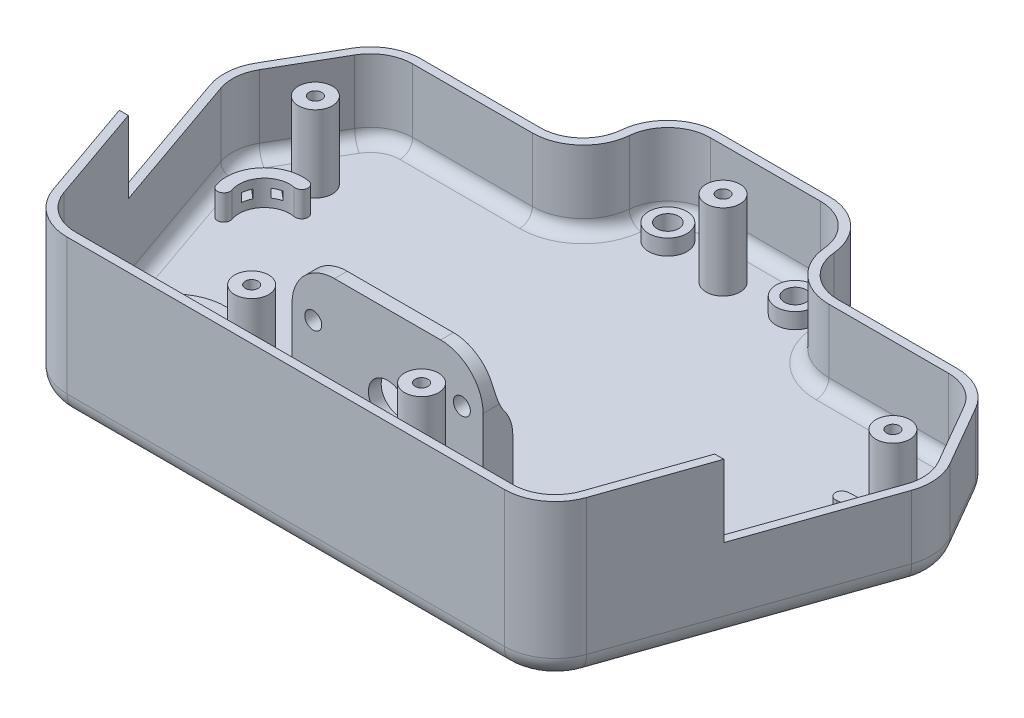
from build123d import *

# Parameters (mm, degrees)
BOSS_EXTRUDE1_DEPTH     = 2
BOSS_EXTRUDE2_DEPTH     = 35
BOSS_EXTRUDE3_START     = -2
SKETCH3_R               = 4.5
BOSS_EXTRUDE3_DEPTH     = 5.7
SKETCH5_R               = 2.55
CUT_EXTRUDE1_DEPTH      = 175.953563197
BOSS_EXTRUDE4_DEPTH     = 6
CUT_EXTRUDE2_REACH      = 176.805
CUT_EXTRUDE2_END_RADIUS = 9
SKETCH7_W               = 2
SKETCH7_H               = 2
SKETCH8_W               = 45
SKETCH8_H               = 34
BOSS_EXTRUDE5_DEPTH     = 3
SKETCH9_W               = 3
SKETCH9_H               = 4
BOSS_EXTRUDE6_DEPTH     = 20
FILLET1_R               = 10
FILLET2_R               = 10
SKETCH11_R              = 12.5
BOSS_EXTRUDE9_DEPTH     = 10
CUT_EXTRUDE3_START      = -3
CUT_EXTRUDE3_DEPTH      = 5
SKETCH14_R              = 2.5
CUT_EXTRUDE4_DEPTH      = 8
SKETCH15_R              = 2
SKETCH15_R_2            = 4.5
CUT_EXTRUDE5_DEPTH      = 3
FILLET3_R               = 10
FILLET4_R               = 12
FILLET5_R               = 10
FILLET6_R               = 3
FILLET7_R               = 5
CUT_EXTRUDE6_DEPTH      = 176.517870935
CUT_EXTRUDE6_DEPTH_BACK = 176.517870935
SKETCH16_W              = 90
SKETCH16_H              = 20
SKETCH17_R              = 4
SKETCH17_R_2            = 1.5
BOSS_EXTRUDE10_DEPTH    = 18
SKETCH19_R              = 4
SKETCH19_R_2            = 1.5
BOSS_EXTRUDE11_DEPTH    = 35


with BuildPart() as part:
    # Sketch1 → Boss-Extrude1 (new body)
    with BuildSketch(Plane(origin=(0, 0, 0), x_dir=(1, 0, 0), z_dir=(0, 1, 0))):
        Polygon((-70, -55), (-25, -55), (-25, -35), (25, -35), (25, -55), (70, -55), (84.43375673, -80), (60, -150), (-60, -150), (-84.43375673, -80), align=None)
    extrude(amount=BOSS_EXTRUDE1_DEPTH)

    # Sketch2 → Boss-Extrude2 (add)
    with BuildSketch(Plane(origin=(0, 2, 0), x_dir=(1, 0, 0), z_dir=(0, 1, 0))):
        Polygon((84.43375673, -80), (70, -55), (25, -55), (25, -35), (-25, -35), (-25, -55), (-70, -55), (-84.43375673, -80), (-60, -150), (60, -150), align=None)
        Polygon((68.845299462, -57), (23, -57), (23, -37), (-23, -37), (-23, -57), (-68.845299462, -57), (-82.243429624, -80.206242168), (-58.579769814, -148), (58.579769814, -148), (82.243429624, -80.206242168), align=None, mode=Mode.SUBTRACT)
    extrude(amount=BOSS_EXTRUDE2_DEPTH)

    # Sketch3 → Boss-Extrude3 (add)
    with BuildSketch(Plane(origin=(0, 2, 0), x_dir=(1, 0, 0), z_dir=(0, 1, 0)).offset(BOSS_EXTRUDE3_START)):
        with Locations(Location((-15, -45, 0), (0, 0, 90))):
            Circle(SKETCH3_R)
        with Locations(Location((15, -45, 0), (0, 0, 90))):
            Circle(SKETCH3_R)
    extrude(amount=BOSS_EXTRUDE3_DEPTH)

    # Sketch5 → Cut-Extrude1 (cut, through all)
    with BuildSketch(Plane(origin=(0, 5.7, 0), x_dir=(1, 0, 0), z_dir=(0, 1, 0))):
        with Locations(Location((-15, -45, 0), (0, 0, 270))):
            Circle(SKETCH5_R)
        with Locations(Location((15, -45, 0), (0, 0, 270))):
            Circle(SKETCH5_R)
    extrude(amount=-CUT_EXTRUDE1_DEPTH, mode=Mode.SUBTRACT)

    # Sketch6 → Boss-Extrude4 (add)
    with BuildSketch(Plane(origin=(0, 2, 0), x_dir=(1, 0, 0), z_dir=(0, 1, 0))):
        with BuildLine():
            ThreePointArc((-63.880004789, -84.105459244), (-69.544824433, -86.082785317), (-70.664819644, -91.977326073))
            ThreePointArc((-70.664819644, -91.977326073), (-71.586693037, -93.887862502), (-73.497229466, -92.965989109))
            ThreePointArc((-73.497229466, -92.965989109), (-71.817236649, -84.124177975), (-63.320007183, -81.158188866))
            ThreePointArc((-63.320007183, -81.158188866), (-62.126370797, -82.911822858), (-63.880004789, -84.105459244))
        make_face()
    boss_extrude4 = extrude(amount=BOSS_EXTRUDE4_DEPTH)

    # Cut-Extrude2: up to this cylinder (the profile starts inside it)
    cut_extrude2_end = Plane(origin=(-65, 5, 90), z_dir=(0, -1, 0)) * Cylinder(CUT_EXTRUDE2_END_RADIUS, 372.61, mode=Mode.PRIVATE)
    # Sketch7 → Cut-Extrude2 (cut, up to the surface)
    with BuildSketch(Plane(origin=(5.508798531, 0, 4.748070429), x_dir=(0.6528691138796593, 0, -0.7574707388024889), z_dir=(0.7574707388024889, 0, 0.6528691138796593)), mode=Mode.PRIVATE) as cut_extrude2_sk1:
        with Locations((-113.108858894, 5)):
            Rectangle(SKETCH7_W, SKETCH7_H)
    cut_extrude2_tool1 = extrude(cut_extrude2_sk1.sketch, amount=-CUT_EXTRUDE2_REACH, mode=Mode.PRIVATE) & cut_extrude2_end
    # Sketch7 → Cut-Extrude2 (cut, up to the surface)
    with BuildSketch(Plane(origin=(5.508798531, 0, 4.748070429), x_dir=(0.6528691138796593, 0, -0.7574707388024889), z_dir=(0.7574707388024889, 0, 0.6528691138796593)), mode=Mode.PRIVATE) as cut_extrude2_sk2:
        with Locations((-108.108858894, 5)):
            Rectangle(SKETCH7_W, SKETCH7_H)
    cut_extrude2_tool2 = extrude(cut_extrude2_sk2.sketch, amount=-CUT_EXTRUDE2_REACH, mode=Mode.PRIVATE) & cut_extrude2_end
    cut_extrude2 = cut_extrude2_tool1.solids().sort_by_distance((-68.336482, 5, 90.424721))[0] + cut_extrude2_tool2.solids().sort_by_distance((-65.072136, 5, 86.637368))[0]
    add(cut_extrude2, mode=Mode.SUBTRACT)

    # Sketch8 → Boss-Extrude5 (add)
    with BuildSketch(Plane(origin=(0, 0, 126), x_dir=(-1, 0, 0), z_dir=(0, 0, -1))):
        with Locations((0, 19)):
            Rectangle(SKETCH8_W, SKETCH8_H)
    extrude(amount=BOSS_EXTRUDE5_DEPTH)

    # Sketch9 → Boss-Extrude6 (add)
    with BuildSketch(Plane(origin=(0, 2, 0), x_dir=(1, 0, 0), z_dir=(0, 1, 0))):
        with Locations((-21, -121)):
            Rectangle(SKETCH9_W, SKETCH9_H)
        with Locations((21, -121)):
            Rectangle(SKETCH9_W, SKETCH9_H)
    extrude(amount=BOSS_EXTRUDE6_DEPTH)

    # Fillet1
    # the kernel refuses this fillet: 10 mm, written as the material it adds along each edge
    with BuildSketch(Plane(origin=(-22.5, 22, 123), x_dir=(0, 0, -1), z_dir=(1, 0, 0))) as fillet1_piece_1:
        with BuildLine():
            CenterArc((10, 8), FILLET1_R, 180, 53.130102354)
            Line((0, 8), (-0.2, 8))
            Line((-0.2, 8), (-0.2, 0))
            Line((-0.2, 0), (0, -0.2))
            ThreePointArc((0, -0.2), (2, -0.2), (3.88, -0.16))
            Line((3.88, -0.16), (4, 0))
        make_face()
    extrude(amount=3)
    with BuildSketch(Plane(origin=(22.5, 22, 123), x_dir=(0, 1, 0), z_dir=(-1, 0, 0))) as fillet1_piece_2:
        with BuildLine():
            CenterArc((8, 10), FILLET1_R, 216.869897646, 53.130102354)
            Line((0, 4), (-0.16, 3.88))
            ThreePointArc((-0.16, 3.88), (-0.2, 2), (-0.2, 0))
            Line((-0.2, 0), (0, -0.2))
            Line((0, -0.2), (8, -0.2))
            Line((8, -0.2), (8, 0))
        make_face()
    extrude(amount=3)

    # Fillet2
    fillet2_edges = [part.edges().sort_by_distance(p)[0] for p in [
        (-21, 22, 119),
        (21, 22, 119),
    ]]
    fillet(fillet2_edges, radius=FILLET2_R)

    # Sketch11 → Boss-Extrude9 (add)
    with BuildSketch(Plane(origin=(0, 2, 0), x_dir=(1, 0, 0), z_dir=(0, 1, 0))):
        with Locations(Location((-43.579769814, -133, 0), (0, 0, 90))):
            Circle(SKETCH11_R)
    boss_extrude9 = extrude(amount=BOSS_EXTRUDE9_DEPTH)

    # Sketch13 → Cut-Extrude3 (cut)
    with BuildSketch(Plane(origin=(0, 7, 0), x_dir=(1, 0, 0), z_dir=(0, 1, 0)).offset(CUT_EXTRUDE3_START)):
        with BuildLine():
            Line((-53.021135888, -136.295543455), (-58.294005416, -121.189357737))
            Line((-58.294005416, -121.189357737), (-39.411273269, -114.598270827))
            Line((-39.411273269, -114.598270827), (-34.138403741, -129.704456545))
            ThreePointArc((-34.138403741, -129.704456545), (-40.28422636, -142.441366074), (-53.021135888, -136.295543455))
        make_face()
    cut_extrude3 = extrude(amount=CUT_EXTRUDE3_DEPTH, mode=Mode.SUBTRACT)

    # Sketch14 → Cut-Extrude4 (cut)
    with BuildSketch(Plane(origin=(0, 12, 0), x_dir=(1, 0, 0), z_dir=(0, 1, 0))):
        with Locations(Location((-43.579769814, -133, 0), (0, 0, 270))):
            Circle(SKETCH14_R)
    cut_extrude4 = extrude(amount=-CUT_EXTRUDE4_DEPTH, mode=Mode.SUBTRACT)

    # Sketch15 → Cut-Extrude5 (cut)
    with BuildSketch(Plane.XY.offset(126)):
        with Locations((17.5, 25)):
            Circle(SKETCH15_R)
        with Locations((-17.5, 25)):
            Circle(SKETCH15_R)
        with Locations((0, 17)):
            Circle(SKETCH15_R_2)
    extrude(amount=-CUT_EXTRUDE5_DEPTH, mode=Mode.SUBTRACT)

    # Mirror1: Boss-Extrude4, Cut-Extrude2, Boss-Extrude9, Cut-Extrude3, Cut-Extrude4 across plane
    add(boss_extrude4.mirror(Plane(origin=(0, 0, 0), x_dir=(0, 0, 1), z_dir=(1, 0, 0))))
    add(cut_extrude2.mirror(Plane(origin=(0, 0, 0), x_dir=(0, 0, 1), z_dir=(1, 0, 0))), mode=Mode.SUBTRACT)
    add(boss_extrude9.mirror(Plane(origin=(0, 0, 0), x_dir=(0, 0, 1), z_dir=(1, 0, 0))))
    add(cut_extrude3.mirror(Plane(origin=(0, 0, 0), x_dir=(0, 0, 1), z_dir=(1, 0, 0))), mode=Mode.SUBTRACT)
    add(cut_extrude4.mirror(Plane(origin=(0, 0, 0), x_dir=(0, 0, 1), z_dir=(1, 0, 0))), mode=Mode.SUBTRACT)

    # Fillet3
    fillet3_edges = [part.edges().sort_by_distance(p)[0] for p in [
        (-25, 18.5, 55),
        (25, 18.5, 55),
        (68.845299462, 19.5, 57),
        (23, 19.5, 37),
        (-23, 19.5, 37),
        (-68.845299462, 19.5, 57),
        (-82.243429624, 19.5, 80.206242168),
        (-58.579769814, 19.5, 148),
        (58.579769814, 19.5, 148),
        (82.243429624, 19.5, 80.206242168),
    ]]
    fillet(fillet3_edges, radius=FILLET3_R)

    # Fillet4
    fillet4_edges = [part.edges().sort_by_distance(p)[0] for p in [
        (-60, 18.5, 150),
        (-84.43375673, 18.5, 80),
        (-70, 18.5, 55),
        (-23, 19.5, 57),
        (-25, 18.5, 35),
        (25, 18.5, 35),
        (23, 19.5, 57),
        (70, 18.5, 55),
        (60, 18.5, 150),
        (84.43375673, 18.5, 80),
    ]]
    fillet(fillet4_edges, radius=FILLET4_R)

    # Fillet5
    fillet5_edges = [part.edges().sort_by_distance(p)[0] for p in [
        (22.5, 36, 124.5),
        (-22.5, 36, 124.5),
    ]]
    fillet(fillet5_edges, radius=FILLET5_R)

    # Fillet6
    # the kernel refuses this fillet: 3 mm, written as the material it adds along each edge
    with BuildSketch(Plane(origin=(13, 2, 37), x_dir=(0, 0, 1), z_dir=(-1, 0, 0))) as fillet6_piece_1:
        with BuildLine():
            CenterArc((FILLET6_R, FILLET6_R), FILLET6_R, 180, 90)
            Line((0, FILLET6_R), (0, 0))
            Line((0, 0), (FILLET6_R, 0))
        make_face()
    extrude(amount=26)
    with BuildSketch(Plane(origin=(60.919984961, 2, 141.295543455), x_dir=(-0.9441366073672659, 0, -0.32955434548649076), z_dir=(0.3295543454864908, 0, -0.9441366073672659)), Plane(origin=(-80.733160169, 2, 84.532996461), x_dir=(0.9441366073672651, 0, -0.329554345486493), z_dir=(0.329554345486493, 0, 0.9441366073672651))) as fillet6_piece_2:
        with BuildLine():
            CenterArc((FILLET6_R, FILLET6_R), FILLET6_R, 180, 90)
            Line((0, FILLET6_R), (0, 0))
            Line((0, 0), (FILLET6_R, 0))
        make_face()
    extrude(amount=60.121116532)
    with BuildSketch(Plane(origin=(79.952048133, 2, 76.237453006), x_dir=(-0.8660254037844397, 0, 0.4999999999999984), z_dir=(-0.49999999999999833, 0, -0.8660254037844397)), Plane(origin=(-71.732050808, 2, 62), x_dir=(0.8660254037844374, 0, 0.5000000000000022), z_dir=(-0.5000000000000022, 0, 0.8660254037844374))) as fillet6_piece_3:
        with BuildLine():
            CenterArc((FILLET6_R, FILLET6_R), FILLET6_R, 180, 90)
            Line((0, FILLET6_R), (0, 0))
            Line((0, 0), (FILLET6_R, 0))
        make_face()
    extrude(amount=16.439994652)
    with BuildSketch(Plane(origin=(63.07179677, 2, 57), x_dir=(0, 0, 1), z_dir=(-1, 0, 0)), Plane(origin=(-34.9089023, 2, 57), x_dir=(0, 0, 1), z_dir=(-1, 0, 0))) as fillet6_piece_4:
        with BuildLine():
            CenterArc((FILLET6_R, FILLET6_R), FILLET6_R, 180, 90)
            Line((0, FILLET6_R), (0, 0))
            Line((0, 0), (FILLET6_R, 0))
        make_face()
    extrude(amount=28.16289447)
    with BuildSketch(Plane(origin=(-51.478618887, 2, 148), x_dir=(0, 0, -1), z_dir=(1, 0, 0))) as fillet6_piece_5:
        with BuildLine():
            CenterArc((FILLET6_R, FILLET6_R), FILLET6_R, 180, 90)
            Line((0, FILLET6_R), (0, 0))
            Line((0, 0), (FILLET6_R, 0))
        make_face()
    extrude(amount=102.957237774)
    with BuildSketch(Plane(origin=(-63.07179677, 2, 67), x_dir=(-0.8660254037844369, 0, -0.5000000000000029), z_dir=(-0.5000000000000029, 0, 0.8660254037844369))) as fillet6_piece_6:
        with BuildLine():
            CenterArc((10 - FILLET6_R, -FILLET6_R), FILLET6_R, 0, 90)
            Line((10, -FILLET6_R), (10, 0))
            Line((10, 0), (10 - FILLET6_R, 0))
        make_face()
    revolve(axis=Axis((-63.07179677, 2, 67), (0, -1, 0)), revolution_arc=60)
    with BuildSketch(Plane(origin=(-71.291794096, 2, 81.237453006), x_dir=(-0.9441366073672652, 0, 0.3295543454864926), z_dir=(0.3295543454864926, 0, 0.9441366073672652))) as fillet6_piece_7:
        with BuildLine():
            CenterArc((10 - FILLET6_R, -FILLET6_R), FILLET6_R, 0, 90)
            Line((10, -FILLET6_R), (10, 0))
            Line((10, 0), (10 - FILLET6_R, 0))
        make_face()
    revolve(axis=Axis((-71.291794096, 2, 81.237453006), (0, -1, 0)), revolution_arc=49.241728317)
    with BuildSketch(Plane(origin=(63.07179677, 2, 67), x_dir=(0.8660254037844395, 0, -0.4999999999999985), z_dir=(0.4999999999999985, 0, 0.8660254037844395))) as fillet6_piece_8:
        with BuildLine():
            CenterArc((10 - FILLET6_R, FILLET6_R), FILLET6_R, 270, 90)
            Line((10, FILLET6_R), (10, 0))
            Line((10, 0), (10 - FILLET6_R, 0))
        make_face()
    revolve(axis=Axis((63.07179677, 2, 67), (0, 1, 0)), revolution_arc=60)
    with BuildSketch(Plane(origin=(71.291794096, 2, 81.237453006), x_dir=(0.8660254037844395, 0, -0.4999999999999985), z_dir=(-0.4999999999999985, 0, -0.8660254037844395))) as fillet6_piece_9:
        with BuildLine():
            CenterArc((10 - FILLET6_R, -FILLET6_R), FILLET6_R, 0, 90)
            Line((10, -FILLET6_R), (10, 0))
            Line((10, 0), (10 - FILLET6_R, 0))
        make_face()
    revolve(axis=Axis((71.291794096, 2, 81.237453006), (0, -1, 0)), revolution_arc=49.241728317)
    with BuildSketch(Plane(origin=(-51.478618887, 2, 138), x_dir=(0, 0, 1), z_dir=(1, 0, 0))) as fillet6_piece_10:
        with BuildLine():
            CenterArc((10 - FILLET6_R, -FILLET6_R), FILLET6_R, 0, 90)
            Line((10, -FILLET6_R), (10, 0))
            Line((10, 0), (10 - FILLET6_R, 0))
        make_face()
    revolve(axis=Axis((-51.478618887, 2, 138), (0, -1, 0)), revolution_arc=70.758271683)
    with BuildSketch(Plane(origin=(51.478618887, 2, 138), x_dir=(0.9441366073672658, 0, 0.3295543454864911), z_dir=(0.3295543454864911, 0, -0.9441366073672658))) as fillet6_piece_11:
        with BuildLine():
            CenterArc((10 - FILLET6_R, -FILLET6_R), FILLET6_R, 0, 90)
            Line((10, -FILLET6_R), (10, 0))
            Line((10, 0), (10 - FILLET6_R, 0))
        make_face()
    revolve(axis=Axis((51.478618887, 2, 138), (0, -1, 0)), revolution_arc=70.758271683)
    with BuildSketch(Plane(origin=(-13, 2, 47), x_dir=(0, 0, -1), z_dir=(1, 0, 0))) as fillet6_piece_12:
        with BuildLine():
            CenterArc((10 - FILLET6_R, FILLET6_R), FILLET6_R, 270, 90)
            Line((10, FILLET6_R), (10, 0))
            Line((10, 0), (10 - FILLET6_R, 0))
        make_face()
    revolve(axis=Axis((-13, 2, 47), (0, 1, 0)), revolution_arc=84.78409143)
    with BuildSketch(Plane(origin=(13, 2, 47), x_dir=(0.9958591954639384, 0, -0.09090909090908993), z_dir=(0.09090909090908993, 0, 0.9958591954639384))) as fillet6_piece_13:
        with BuildLine():
            CenterArc((10 - FILLET6_R, FILLET6_R), FILLET6_R, 270, 90)
            Line((10, FILLET6_R), (10, 0))
            Line((10, 0), (10 - FILLET6_R, 0))
        make_face()
    revolve(axis=Axis((13, 2, 47), (0, 1, 0)), revolution_arc=84.78409143)
    with BuildSketch(Plane(origin=(-34.908902287, 2, 45.000000012), x_dir=(0.9958591955436892, 0, 0.09090909003546413), z_dir=(0.09090909003546413, 0, -0.9958591955436892))) as fillet6_piece_14:
        with BuildLine():
            CenterArc((11.999999986 + FILLET6_R * 0.999999998833, -FILLET6_R), FILLET6_R, 90, 90)
            Line((11.999999986 - FILLET6_R * 1.16654656305e-09, -FILLET6_R), (11.999999986, 0))
            Line((11.999999986, 0), (11.999999986 + FILLET6_R * 0.999999998833, 0))
        make_face()
    revolve(axis=Axis((-34.908902287, 2, 45.000000012), (0, -1, 0)), revolution_arc=84.784091541)
    with BuildSketch(Plane(origin=(34.908902293, 2, 45.000000005), x_dir=(5.653936580631347e-10, 0, 1.0), z_dir=(1.0, 0, -5.653936580631347e-10))) as fillet6_piece_15:
        with BuildLine():
            CenterArc((11.999999995 + FILLET6_R * 0.999999998929, -FILLET6_R), FILLET6_R, 90, 90)
            Line((11.999999995 - FILLET6_R * 1.07127817728e-09, -FILLET6_R), (11.999999995, 0))
            Line((11.999999995, 0), (11.999999995 + FILLET6_R * 0.999999998929, 0))
        make_face()
    revolve(axis=Axis((34.908902293, 2, 45.000000005), (0, -1, 0)), revolution_arc=84.784091484)

    # Fillet7
    fillet7_edges = [part.edges().sort_by_distance(p)[0] for p in [
        (-49.035898385, 0, 55),
        (-28.258001375, 0, 52.385489459),
        (0, 0, 150),
        (-77.574100278, 0, 68.118726503),
        (0, 0, 35),
        (28.258001375, 0, 52.385489459),
        (49.035898385, 0, 55),
        (77.574100278, 0, 68.118726503),
        (72.71484578, 0, 113.573378649),
        (-72.71484578, 0, 113.573378649),
        (83.238948111, 0, 80.112503707),
        (58.426430566, 0, 147.784064231),
        (69.07179677, 0, 56.607695155),
        (21.181496049, 0, 38.137412649),
        (-21.181496049, 0, 38.137412649),
        (-69.07179677, 0, 56.607695155),
        (-83.238948111, 0, 80.112503707),
        (-58.426430566, 0, 147.784064231),
    ]]
    fillet(fillet7_edges, radius=FILLET7_R)

    # Sketch16 → Cut-Extrude6 (cut, two sides: drawn at the far end of the back side and taken through both)
    with BuildSketch(Plane(origin=(0, 0, 0), x_dir=(0, 0, -1), z_dir=(1, 0, 0)).offset(-CUT_EXTRUDE6_DEPTH_BACK)):
        with Locations((-73, 30)):
            Rectangle(SKETCH16_W, SKETCH16_H)
    extrude(amount=CUT_EXTRUDE6_DEPTH + CUT_EXTRUDE6_DEPTH_BACK, mode=Mode.SUBTRACT)

    # Sketch17 → Boss-Extrude10 (add)
    # profile 1 of 3: a face of its own
    with BuildSketch(Plane(origin=(0, 2, 0), x_dir=(1, 0, 0), z_dir=(0, 1, 0))):
        with Locations(Location((0, -47, 0), (0, 0, 90))):
            Circle(SKETCH17_R)
        with Locations(Location((0, -47, 0), (0, 0, 90))):
            Circle(SKETCH17_R_2, mode=Mode.SUBTRACT)
    # profile 2 of 3: a face of its own
    with BuildSketch(Plane(origin=(0, 2, 0), x_dir=(1, 0, 0), z_dir=(0, 1, 0))):
        with Locations(Location((-68, -75, 0), (0, 0, 90))):
            Circle(SKETCH17_R)
        with Locations(Location((-68, -75, 0), (0, 0, 90))):
            Circle(SKETCH17_R_2, mode=Mode.SUBTRACT)
    # profile 3 of 3: a face of its own
    with BuildSketch(Plane(origin=(0, 2, 0), x_dir=(1, 0, 0), z_dir=(0, 1, 0))):
        with Locations(Location((68, -75, 0), (0, 0, 90))):
            Circle(SKETCH17_R)
        with Locations(Location((68, -75, 0), (0, 0, 90))):
            Circle(SKETCH17_R_2, mode=Mode.SUBTRACT)
    extrude(amount=BOSS_EXTRUDE10_DEPTH)

    # Sketch19 → Boss-Extrude11 (add)
    # profile 1 of 2: a face of its own
    with BuildSketch(Plane(origin=(0, 2, 0), x_dir=(1, 0, 0), z_dir=(0, 1, 0))):
        with Locations(Location((-20, -138, 0), (0, 0, 90))):
            Circle(SKETCH19_R)
        with Locations(Location((-20, -138, 0), (0, 0, 270))):
            Circle(SKETCH19_R_2, mode=Mode.SUBTRACT)
    # profile 2 of 2: a face of its own
    with BuildSketch(Plane(origin=(0, 2, 0), x_dir=(1, 0, 0), z_dir=(0, 1, 0))):
        with Locations(Location((20, -138, 0), (0, 0, 90))):
            Circle(SKETCH19_R)
        with Locations(Location((20, -138, 0), (0, 0, 90))):
            Circle(SKETCH19_R_2, mode=Mode.SUBTRACT)
    extrude(amount=BOSS_EXTRUDE11_DEPTH)


solid = part.part
